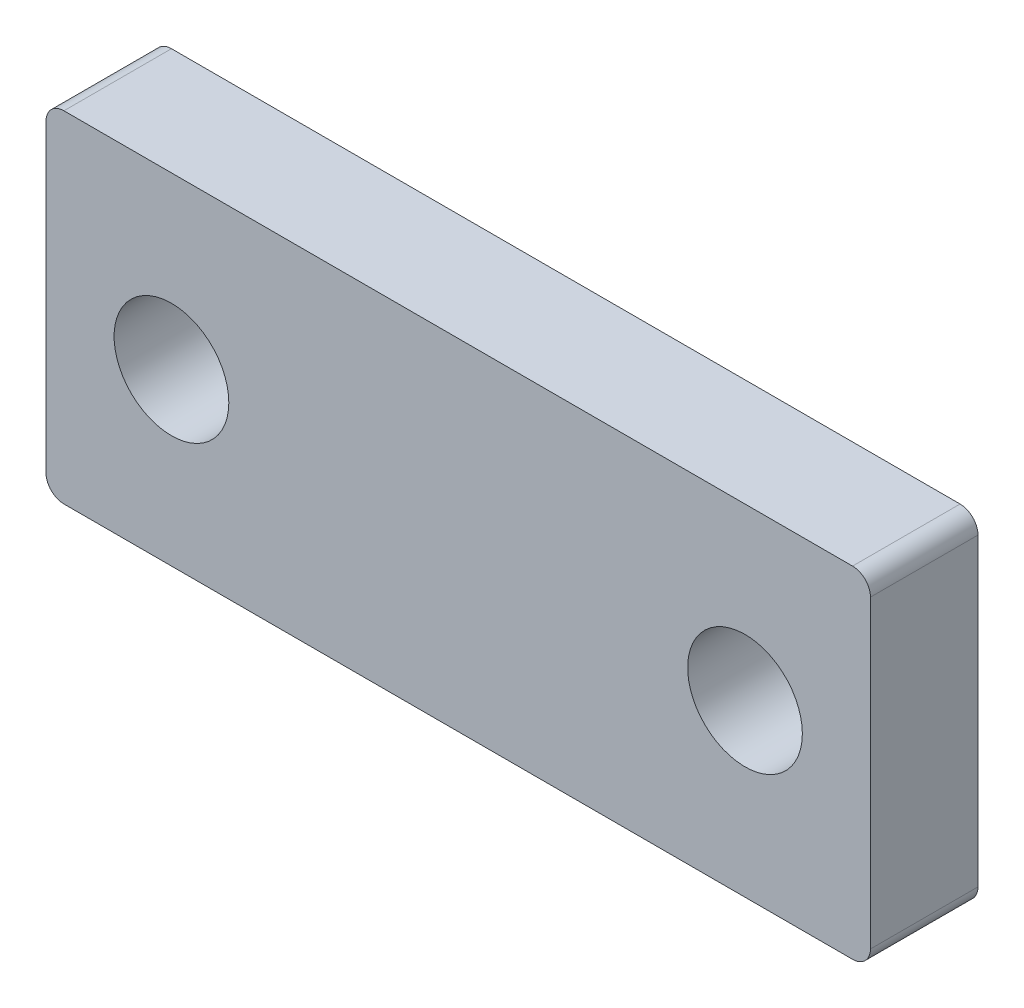
from build123d import *

# Parameters (mm, degrees)
SKETCH1_W            = 23
SKETCH1_H            = 9.5
BOSS_EXTRUDE1_DEPTH  = 3
M3_CLEARANCE_HOLE1_D = 3.2
FILLET1_R            = 0.5


with BuildPart() as part:
    # Sketch1 → Boss-Extrude1 (new body)
    with BuildSketch(Plane.XY):
        Rectangle(SKETCH1_W, SKETCH1_H)
    extrude(amount=BOSS_EXTRUDE1_DEPTH)

    # M3 Clearance Hole1 (through all)
    with Locations(Plane.XY.offset(3)):
        with Locations((-8, 0), (8, 0)):
            Hole(M3_CLEARANCE_HOLE1_D / 2)

    # Fillet1
    fillet1_edges = [part.edges().sort_by_distance(p)[0] for p in [
        (11.5, 4.75, 1.5),
        (11.5, -4.75, 1.5),
        (-11.5, -4.75, 1.5),
        (-11.5, 4.75, 1.5),
    ]]
    fillet(fillet1_edges, radius=FILLET1_R)


solid = part.part
